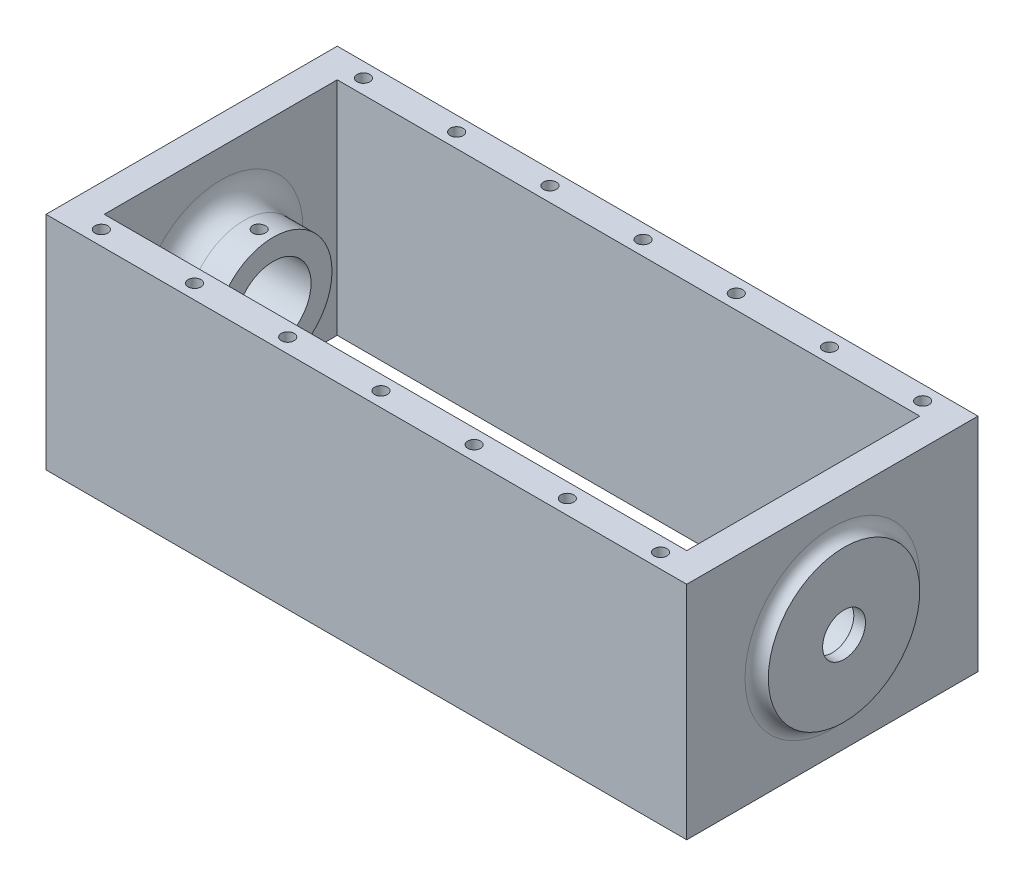
from build123d import *

# Parameters (mm, degrees)
SKETCH1_W           = 139.7
SKETCH1_H           = 63.5
BOSS_EXTRUDE1_DEPTH = 3.81
SKETCH2_W           = 139.7
SKETCH2_H           = 63.5
SKETCH2_W_2         = 127
SKETCH2_H_2         = 50.8
BOSS_EXTRUDE2_DEPTH = 48.26
SKETCH3_R           = 8.255
CUT_EXTRUDE1_DEPTH  = 150.114
SKETCH4_W           = 139.7
SKETCH4_H           = 63.5
CUT_EXTRUDE2_DEPTH  = 3.81
SKETCH5_R           = 12.7
SKETCH5_R_2         = 8.255
BOSS_EXTRUDE3_DEPTH = 11.43
FILLET1_R           = 5.08
BOSS_EXTRUDE4_START = 11.43
SKETCH6_R           = 12.827
SKETCH6_R_2         = 8.255
BOSS_EXTRUDE4_DEPTH = 11.43
FILLET2_R           = 5.08
SKETCH7_R           = 1.4
CUT_EXTRUDE3_DEPTH  = 158.842199202
SKETCH8_R           = 1.4
CUT_EXTRUDE4_DEPTH  = 158.842199202
SKETCH9_R           = 16.51
SKETCH9_R_2         = 4.6745
BOSS_EXTRUDE5_DEPTH = 2.54
FILLET3_R           = 2.54
BOSS_EXTRUDE6_START = 2.54
SKETCH10_R          = 16.51
SKETCH10_R_2        = 4.6745
BOSS_EXTRUDE6_DEPTH = 2.54
FILLET4_R           = 2.54
SKETCH11_R          = 1.4
CUT_EXTRUDE5_DEPTH  = 3.81


with BuildPart() as part:
    # Sketch1 → Boss-Extrude1 (new body)
    with BuildSketch(Plane(origin=(0, 0, 0), x_dir=(1, 0, 0), z_dir=(0, 1, 0))):
        with Locations((69.85, 31.75)):
            Rectangle(SKETCH1_W, SKETCH1_H)
    extrude(amount=BOSS_EXTRUDE1_DEPTH)

    # Sketch2 → Boss-Extrude2 (add)
    with BuildSketch(Plane(origin=(0, 3.81, 0), x_dir=(1, 0, 0), z_dir=(0, 1, 0))):
        with Locations((69.85, 31.75)):
            Rectangle(SKETCH2_W, SKETCH2_H)
        with Locations((69.85, 31.75)):
            Rectangle(SKETCH2_W_2, SKETCH2_H_2, mode=Mode.SUBTRACT)
    extrude(amount=BOSS_EXTRUDE2_DEPTH)

    # Sketch3 → Cut-Extrude1 (cut)
    with BuildSketch(Plane(origin=(139.7, 0, 0), x_dir=(0, 0, -1), z_dir=(1, 0, 0))):
        with Locations((31.75, 27.94)):
            Circle(SKETCH3_R)
    extrude(amount=-CUT_EXTRUDE1_DEPTH, mode=Mode.SUBTRACT)

    # Sketch4 → Cut-Extrude2 (cut)
    with BuildSketch(Plane.XZ):
        with Locations((69.85, -31.75)):
            Rectangle(SKETCH4_W, SKETCH4_H)
    extrude(amount=-CUT_EXTRUDE2_DEPTH, mode=Mode.SUBTRACT)

    # Sketch5 → Boss-Extrude3 (add)
    with BuildSketch(Plane.ZY.offset(-133.35)):
        with Locations(Location((-31.75, 27.94, 0), (0, 0, 180))):
            Circle(SKETCH5_R)
        with Locations(Location((-31.75, 27.94, 0), (0, 0, 180))):
            Circle(SKETCH5_R_2, mode=Mode.SUBTRACT)
    extrude(amount=BOSS_EXTRUDE3_DEPTH)

    # Fillet1
    fillet1_edges = [part.edges().sort_by_distance(p)[0] for p in [
        (133.35, 27.94, -19.05),
    ]]
    fillet(fillet1_edges, radius=FILLET1_R)

    # Sketch6 → Boss-Extrude4 (add)
    with BuildSketch(Plane(origin=(6.35, 0, 0), x_dir=(0, 0, -1), z_dir=(1, 0, 0)).offset(BOSS_EXTRUDE4_START)):
        with Locations((31.75, 27.94)):
            Circle(SKETCH6_R)
        with Locations((31.75, 27.94)):
            Circle(SKETCH6_R_2, mode=Mode.SUBTRACT)
    extrude(amount=-BOSS_EXTRUDE4_DEPTH)

    # Fillet2
    fillet2_edges = [part.edges().sort_by_distance(p)[0] for p in [
        (6.35, 27.94, -18.923),
    ]]
    fillet(fillet2_edges, radius=FILLET2_R)

    # Sketch7 → Cut-Extrude3 (cut, through all)
    with BuildSketch(Plane(origin=(0, 40.767, 0), x_dir=(1, 0, 0), z_dir=(0, 1, 0))):
        with Locations(Location((14.732, 31.75, 0), (0, 0, 270))):
            Circle(SKETCH7_R)
    extrude(amount=-CUT_EXTRUDE3_DEPTH, mode=Mode.SUBTRACT)

    # Sketch8 → Cut-Extrude4 (cut, through all)
    with BuildSketch(Plane(origin=(0, 40.767, 0), x_dir=(1, 0, 0), z_dir=(0, 1, 0))):
        with Locations(Location((124.968, 31.75, 0), (0, 0, 270))):
            Circle(SKETCH8_R)
    extrude(amount=-CUT_EXTRUDE4_DEPTH, mode=Mode.SUBTRACT)

    # Sketch9 → Boss-Extrude5 (add)
    with BuildSketch(Plane.ZY):
        with Locations(Location((-31.75, 27.94, 0), (0, 0, 180))):
            Circle(SKETCH9_R)
        with Locations((-31.75, 27.94)):
            Circle(SKETCH9_R_2, mode=Mode.SUBTRACT)
    extrude(amount=BOSS_EXTRUDE5_DEPTH)

    # Fillet3
    fillet3_edges = [part.edges().sort_by_distance(p)[0] for p in [
        (0, 27.94, -15.24),
    ]]
    fillet(fillet3_edges, radius=FILLET3_R - 0.0001)  # a hair under: the kernel refuses the full size

    # Sketch10 → Boss-Extrude6 (add)
    with BuildSketch(Plane(origin=(139.7, 0, 0), x_dir=(0, 0, -1), z_dir=(1, 0, 0)).offset(BOSS_EXTRUDE6_START)):
        with Locations(Location((31.75, 27.94, 0), (0, 0, 180))):
            Circle(SKETCH10_R)
        with Locations(Location((31.75, 27.94, 0), (0, 0, 180))):
            Circle(SKETCH10_R_2, mode=Mode.SUBTRACT)
    extrude(amount=-BOSS_EXTRUDE6_DEPTH)

    # Fillet4
    fillet4_edges = [part.edges().sort_by_distance(p)[0] for p in [
        (139.7, 27.94, -48.26),
    ]]
    fillet(fillet4_edges, radius=FILLET4_R - 0.0001)  # a hair under: the kernel refuses the full size

    # Sketch11 → Cut-Extrude5 (cut)
    with BuildSketch(Plane(origin=(0, 52.07, 0), x_dir=(1, 0, 0), z_dir=(0, 1, 0))):
        with Locations(Location((69.85, 60.325, 0), (0, 0, 270))):
            Circle(SKETCH11_R)
        with Locations(Location((69.85, 3.175, 0), (0, 0, 270))):
            Circle(SKETCH11_R)
        with Locations(Location((49.53, 60.325, 0), (0, 0, 270))):
            Circle(SKETCH11_R)
        with Locations(Location((29.21, 60.325, 0), (0, 0, 270))):
            Circle(SKETCH11_R)
        with Locations(Location((8.89, 60.325, 0), (0, 0, 270))):
            Circle(SKETCH11_R)
        with Locations(Location((90.17, 60.325, 0), (0, 0, 270))):
            Circle(SKETCH11_R)
        with Locations(Location((110.49, 60.325, 0), (0, 0, 270))):
            Circle(SKETCH11_R)
        with Locations(Location((130.81, 60.325, 0), (0, 0, 270))):
            Circle(SKETCH11_R)
        with Locations(Location((90.17, 3.175, 0), (0, 0, 270))):
            Circle(SKETCH11_R)
        with Locations(Location((110.49, 3.175, 0), (0, 0, 270))):
            Circle(SKETCH11_R)
        with Locations(Location((130.81, 3.175, 0), (0, 0, 270))):
            Circle(SKETCH11_R)
        with Locations(Location((49.53, 3.175, 0), (0, 0, 270))):
            Circle(SKETCH11_R)
        with Locations(Location((29.21, 3.175, 0), (0, 0, 270))):
            Circle(SKETCH11_R)
        with Locations(Location((8.89, 3.175, 0), (0, 0, 270))):
            Circle(SKETCH11_R)
    cut_extrude5 = extrude(amount=-CUT_EXTRUDE5_DEPTH, mode=Mode.SUBTRACT)

    # Mirror1: Cut-Extrude5 across plane
    add(cut_extrude5.mirror(Plane.ZX.offset(27.94)), mode=Mode.SUBTRACT)


solid = part.part
